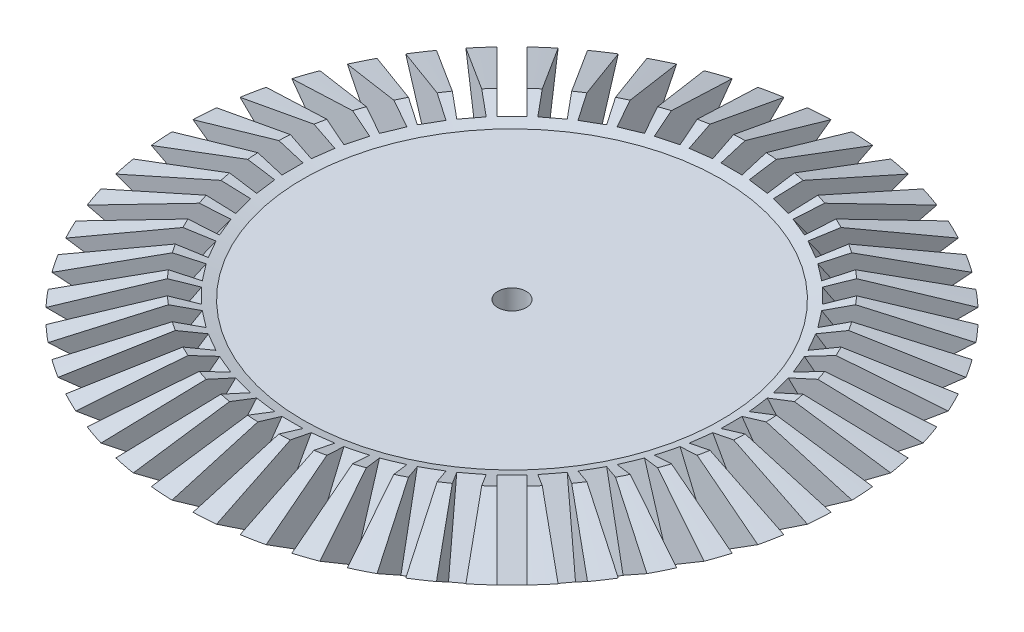
from build123d import *

# Parameters (mm, degrees)
SKETCH13_W          = 2.3876
SKETCH13_H          = 12.71299084
CUT_EXTRUDE4_DEPTH  = 66.83350417
CIRPATTERN1_COUNT   = 48
SKETCH15_R          = 3.2004
SKETCH15_R_2        = 1.5875
BOSS_EXTRUDE3_DEPTH = 12.7
SKETCH18_R          = 1.6129
CUT_EXTRUDE7_DEPTH  = 55.510592759


# Read off the part's stored shape, not the designer's step: the revolve step
with BuildPart() as part:
    # Revolve f outline → Revolve f (revolve)
    with BuildSketch(Plane.XY):
        Polygon((0, -6.189666461), (29.159913132, -6.189666461), (37.5031, -0.301114567), (27.745033324, 2.528326146), (23.767072517, 1.325967621), (0, 1.325967621), align=None)
    revolve(axis=Axis((0, 0, 0), (0, 1, 0)))

    # Sketch13 → Cut-Extrude4 (cut, through all)
    with BuildSketch(Plane(origin=(-1.615e-06, -17.869128836, 12.611882498), x_dir=(-0.9999999999999973, 6.0310255814282e-08, -4.256647689621411e-08), z_dir=(-7.381891296774874e-08, -0.8170027624306984, 0.5766337539379762))):
        with Locations((0, -27.735234346)):
            Rectangle(SKETCH13_W, SKETCH13_H)
    cut_extrude4 = extrude(amount=-CUT_EXTRUDE4_DEPTH, mode=Mode.SUBTRACT)

    # CirPattern1: Cut-Extrude4 ×48 about axis
    cirpattern1_axis = Axis((0, 0, 0), (0, 1, 0))
    for i in range(1, CIRPATTERN1_COUNT):
        add(cut_extrude4.rotate(cirpattern1_axis, i * 360 / CIRPATTERN1_COUNT), mode=Mode.SUBTRACT)

    # Sketch15 → Boss-Extrude3 (add)
    with BuildSketch(Plane.XZ.offset(6.189666461)):
        with Locations(Location((0, 0, 0), (0, 0, 270))):
            Circle(SKETCH15_R)
        with Locations(Location((0, 0, 0), (0, 0, 270))):
            Circle(SKETCH15_R_2, mode=Mode.SUBTRACT)
    extrude(amount=BOSS_EXTRUDE3_DEPTH)

    # Sketch18 → Cut-Extrude7 (cut, through all)
    with BuildSketch(Plane.XZ.offset(6.189666461)):
        with Locations(Location((0, 0, 0), (0, 0, 270))):
            Circle(SKETCH18_R)
    extrude(amount=-CUT_EXTRUDE7_DEPTH, mode=Mode.SUBTRACT)


solid = part.part
